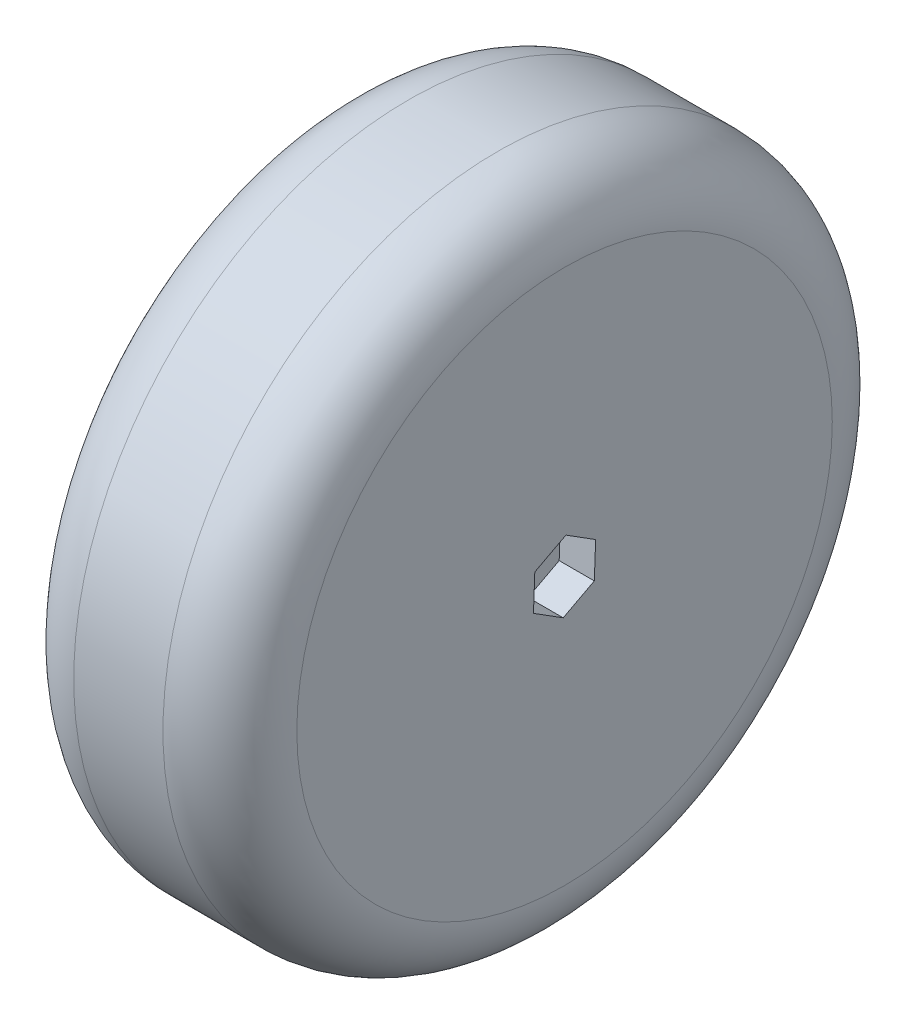
from build123d import *

# Parameters (mm, degrees)
SKETCH2_R           = 38.1
BOSS_EXTRUDE2_DEPTH = 25.4
FILLET3_R           = 7.62
FILLET5_R           = 7.62
SKETCH4_R           = 1.7
CUT_EXTRUDE1_DEPTH  = 25.4
CUT_EXTRUDE2_DEPTH  = 4


with BuildPart() as part:
    # Sketch2 → Boss-Extrude2 (new body)
    with BuildSketch(Plane(origin=(0, 0, 0), x_dir=(0, 0, -1), z_dir=(1, 0, 0))):
        Circle(SKETCH2_R)
    extrude(amount=BOSS_EXTRUDE2_DEPTH)

    # Fillet3
    fillet3_edges = [part.edges().sort_by_distance(p)[0] for p in [
        (25.4, 0, 38.1),
    ]]
    fillet(fillet3_edges, radius=FILLET3_R)

    # Fillet5
    fillet5_edges = [part.edges().sort_by_distance(p)[0] for p in [
        (0, 0, 38.1),
    ]]
    fillet(fillet5_edges, radius=FILLET5_R)

    # Sketch4 → Cut-Extrude1 (cut)
    with BuildSketch(Plane(origin=(25.4, 0, 0), x_dir=(0, 0, -1), z_dir=(1, 0, 0))):
        Circle(SKETCH4_R)
    extrude(amount=-CUT_EXTRUDE1_DEPTH, mode=Mode.SUBTRACT)

    # Sketch5 → Cut-Extrude2 (cut)
    with BuildSketch(Plane(origin=(25.4, 0, 0), x_dir=(0, 0, -1), z_dir=(1, 0, 0))):
        Polygon((-3.387274931, 2.13272866), (-3.540634665, -1.86710181), (-0.153359734, -3.99983047), (3.387274931, -2.13272866), (3.540634665, 1.86710181), (0.153359734, 3.99983047), align=None)
    extrude(amount=-CUT_EXTRUDE2_DEPTH, mode=Mode.SUBTRACT)


solid = part.part
